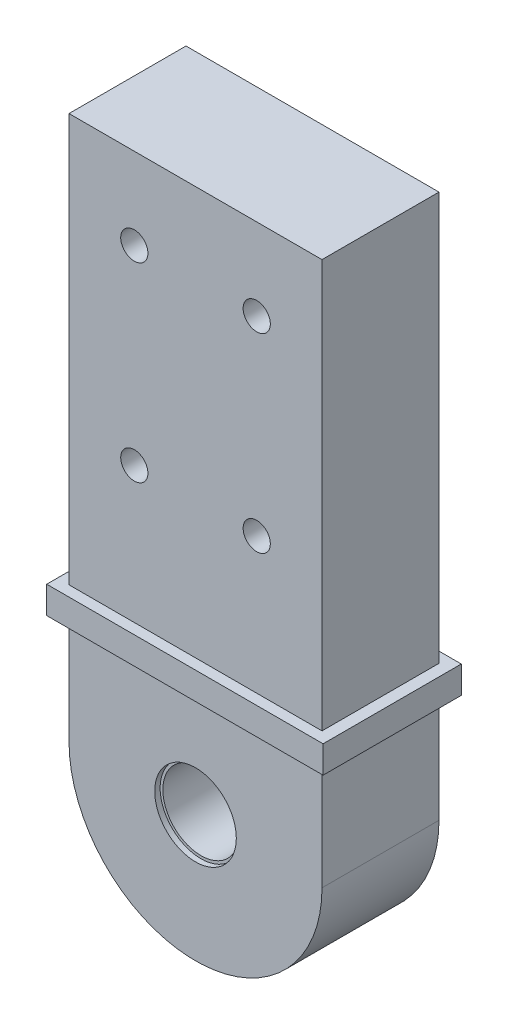
from build123d import *

# Parameters (mm, degrees)
SKETCH1_R           = 7
SKETCH1_R_2         = 2.5
BOSS_EXTRUDE1_DEPTH = 21.5
SKETCH2_R           = 7.5
CUT_EXTRUDE1_DEPTH  = 1
CUT_EXTRUDE2_START  = -1
SKETCH3_R           = 7.5
CUT_EXTRUDE2_DEPTH  = 1
SKETCH5_W           = 50.8
SKETCH5_H           = 25.4
SKETCH5_W_2         = 46.5
SKETCH5_H_2         = 21.5
BOSS_EXTRUDE2_DEPTH = 5


with BuildPart() as part:
    # Sketch1 → Boss-Extrude1 (new body)
    with BuildSketch(Plane.XY):
        with BuildLine():
            Line((-23.25, 0), (-23.25, 100))
            Line((-23.25, 100), (23.25, 100))
            Line((23.25, 100), (23.25, 0))
            ThreePointArc((23.25, 0), (0, -23.25), (-23.25, 0))
        make_face()
        Circle(SKETCH1_R, mode=Mode.SUBTRACT)
        with Locations((-11.25, 85)):
            Circle(SKETCH1_R_2, mode=Mode.SUBTRACT)
        with Locations((11.25, 85)):
            Circle(SKETCH1_R_2, mode=Mode.SUBTRACT)
        with Locations((11.25, 50)):
            Circle(SKETCH1_R_2, mode=Mode.SUBTRACT)
        with Locations((-11.25, 50)):
            Circle(SKETCH1_R_2, mode=Mode.SUBTRACT)
    extrude(amount=BOSS_EXTRUDE1_DEPTH)

    # Sketch2 → Cut-Extrude1 (cut)
    with BuildSketch(Plane.XY.offset(21.5)):
        Circle(SKETCH2_R)
    extrude(amount=-CUT_EXTRUDE1_DEPTH, mode=Mode.SUBTRACT)

    # Sketch3 → Cut-Extrude2 (cut)
    with BuildSketch(Plane(origin=(0, 0, 0), x_dir=(-1, 0, 0), z_dir=(0, 0, -1)).offset(CUT_EXTRUDE2_START)):
        Circle(SKETCH3_R)
    extrude(amount=CUT_EXTRUDE2_DEPTH, mode=Mode.SUBTRACT)

    # Sketch5 → Boss-Extrude2 (add)
    with BuildSketch(Plane(origin=(0, 24.981, 0), x_dir=(1, 0, 0), z_dir=(0, 1, 0))):
        with Locations((0, -10.75)):
            Rectangle(SKETCH5_W, SKETCH5_H)
        with Locations((0, -10.75)):
            Rectangle(SKETCH5_W_2, SKETCH5_H_2, mode=Mode.SUBTRACT)
    extrude(amount=-BOSS_EXTRUDE2_DEPTH)


solid = part.part
